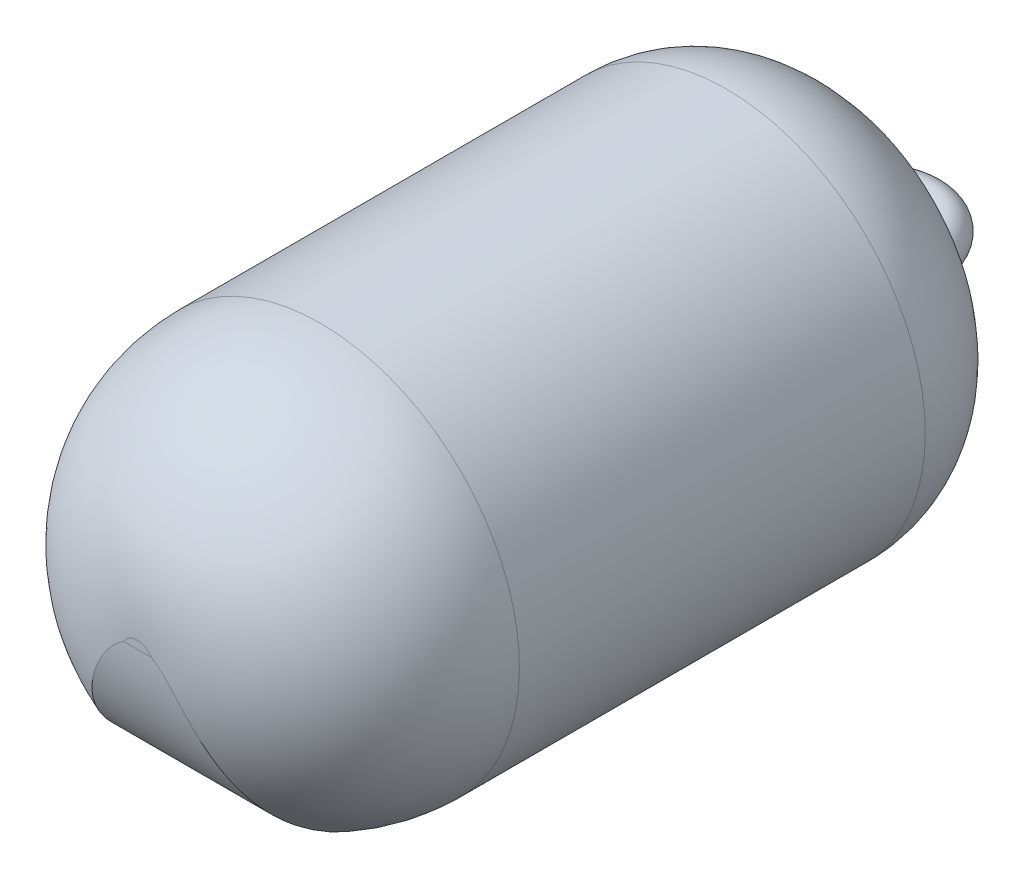
from build123d import *

# Parameters (mm, degrees)
CROQUIS1_R              = 25
SALIENTE_EXTRUIR1_DEPTH = 90
CROQUIS4_R              = 2.5
REDONDEO2_R             = 16
CORTAR_EXTRUIR2_START   = -22
CROQUIS12_W             = 90
CROQUIS12_H             = 90
CORTAR_EXTRUIR2_DEPTH   = 30
REDONDEO3_R             = 23


with BuildPart() as part:
    # Croquis1 → Saliente-Extruir1 (new body)
    with BuildSketch(Plane.XY):
        with Locations(Location((0, 0, 0), (0, 0, 180))):
            Circle(CROQUIS1_R)
    extrude(amount=SALIENTE_EXTRUIR1_DEPTH)

    # Barrer3: sweep along a path in Croquis3
    with BuildLine(Plane(origin=(0, 0, 0), x_dir=(1, 0, 0), z_dir=(0, 1, 0))) as barrer3_path:
        Line((-3, 0), (-3, 3))
        ThreePointArc((-3, 3), (0, 6), (3, 3))
        Line((3, 3), (3, 0))
    # Croquis4 → Barrer3 (sweep)
    with BuildSketch(Plane(origin=(0, 0, 0), x_dir=(-1, 0, 0), z_dir=(0, 0, -1))):
        with Locations((-6, 0)):
            Circle(CROQUIS4_R)
    sweep(path=barrer3_path.line)

    # Redondeo2
    redondeo2_edges = [part.edges().sort_by_distance(p)[0] for p in [
        (25, 0, 0),
    ]]
    fillet(redondeo2_edges, radius=REDONDEO2_R)

    # Croquis12 → Cortar-Extruir2 (cut)
    with BuildSketch(Plane(origin=(0, 0, 0), x_dir=(1, 0, 0), z_dir=(0, 1, 0)).offset(CORTAR_EXTRUIR2_START)):
        with Locations((-20, -45)):
            Rectangle(CROQUIS12_W, CROQUIS12_H)
    extrude(amount=-CORTAR_EXTRUIR2_DEPTH, mode=Mode.SUBTRACT)

    # Redondeo3
    # the kernel refuses this fillet: 23 mm, written as the material it takes off along each edge
    with BuildSketch(Plane(origin=(0, 0, 90), x_dir=(-0.003141587485819883, -0.9999950652018583, 0), z_dir=(0.9999950652018583, -0.003141587485819883, 0))) as redondeo3_piece_1:
        with BuildLine():
            CenterArc((25 - REDONDEO3_R, REDONDEO3_R), REDONDEO3_R, 270, 90)
            Line((25 - REDONDEO3_R, 0), (25, 0))
            Line((25, 0), (25, REDONDEO3_R))
        make_face()
    revolve(axis=Axis((0, 0, 90), (0, 0, -1)), revolution_arc=359.64, mode=Mode.SUBTRACT)
    with BuildSketch(Plane(origin=(69.374342087, -22, 90), x_dir=(0, 1, 0), z_dir=(-1, 0, 0))) as redondeo3_piece_2:
        with BuildLine():
            CenterArc((REDONDEO3_R, REDONDEO3_R), REDONDEO3_R, 180, 90)
            Line((0, REDONDEO3_R), (0, 0))
            Line((0, 0), (REDONDEO3_R, 0))
        make_face()
    extrude(amount=138.748684174, mode=Mode.SUBTRACT)


solid = part.part
